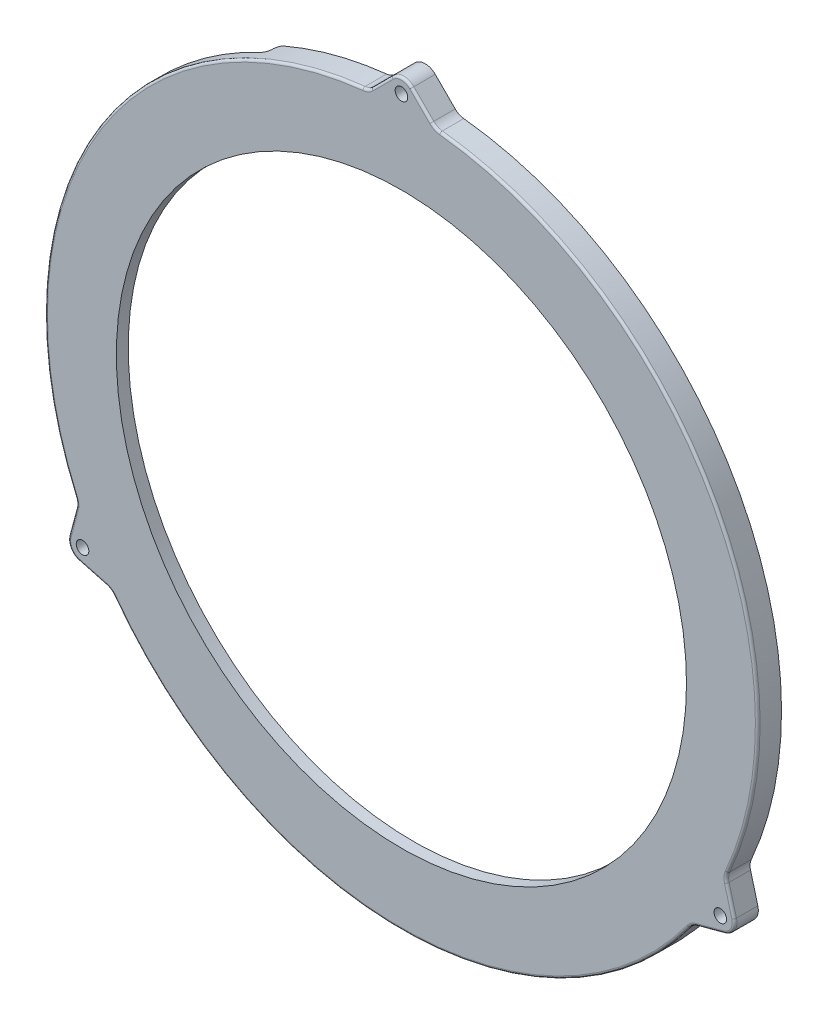
from build123d import *
from build123d.topology import SkipClean

# Parameters (mm, degrees)
SKETCH1_R                = 150
SKETCH1_R_2              = 140
BOSS_EXTRUDE1_DEPTH      = 5
SKETCH2_R                = 150
SKETCH2_R_2              = 120
BOSS_EXTRUDE2_DEPTH      = 5
BOSS_EXTRUDE3_START      = -10
SKETCH3_R                = 2.65
BOSS_EXTRUDE3_DEPTH      = 10
FILLET1_R                = 6
CIRPATTERN1_COUNT        = 3
FILLET1_OF_CIRPATTERN1_R = 6
FILLET2_R                = 1
CUT_EXTRUDE2_DEPTH       = 5
FILLET3_R                = 2.5


with BuildPart() as part:
    # Sketch1 → Boss-Extrude1 (new body)
    with BuildSketch(Plane.XY):
        Circle(SKETCH1_R)
        Circle(SKETCH1_R_2, mode=Mode.SUBTRACT)
    extrude(amount=BOSS_EXTRUDE1_DEPTH)

    # Sketch2 → Boss-Extrude2 (add)
    with BuildSketch(Plane.XY.offset(5)):
        Circle(SKETCH2_R)
        Circle(SKETCH2_R_2, mode=Mode.SUBTRACT)
    extrude(amount=BOSS_EXTRUDE2_DEPTH)

    # Sketch3 → Boss-Extrude3 (add)
    with BuildSketch(Plane.XY.offset(10).offset(BOSS_EXTRUDE3_START)):
        with BuildLine():
            ThreePointArc((-14.154618867, 149.330662507), (0, 150), (14.154618867, 149.330662507))
            Line((14.154618867, 149.330662507), (4.242640687, 159.242640687))
            ThreePointArc((4.242640687, 159.242640687), (0, 161), (-4.242640687, 159.242640687))
            Line((-4.242640687, 159.242640687), (-14.154618867, 149.330662507))
        make_face()
        with Locations((0, 155)):
            Circle(SKETCH3_R, mode=Mode.SUBTRACT)
    boss_extrude3 = extrude(amount=BOSS_EXTRUDE3_DEPTH)

    # Fillet1
    fillet1_edges = [part.edges().sort_by_distance(p)[0] for p in [
        (-14.154618867, 149.330662507, 5),
        (14.154618867, 149.330662507, 5),
    ]]
    fillet(fillet1_edges, radius=FILLET1_R)

    # CirPattern1: Boss-Extrude3 ×3 about axis
    cirpattern1_axis = Axis((0, 0, 0), (0, 0, 1))
    for i in range(1, CIRPATTERN1_COUNT):
        add(boss_extrude3.rotate(cirpattern1_axis, i * 360 / CIRPATTERN1_COUNT))

    # Fillet1 of CirPattern1
    fillet1_of_cirpattern1_edges = [part.edges().sort_by_distance(p)[0] for p in [
        (-122.246837861, -86.923590773, 5),
        (-136.401456729, -62.407071733, 5),
        (136.401456729, -62.407071733, 5),
        (122.246837861, -86.923590773, 5),
    ]]
    fillet(fillet1_of_cirpattern1_edges, radius=FILLET1_OF_CIRPATTERN1_R)

    # Fillet2
    fillet2_edges = [part.edges().sort_by_distance(p)[0] for p in [
        (8.443648708, 155.041632666, 10),
        (0, 161, 10),
        (-8.443648708, 155.041632666, 10),
        (-129.903810568, 75, 10),
        (-14.29409564, 149.672599518, 10),
        (14.29409564, 149.672599518, 10),
        (-138.491816887, -70.208402051, 10),
        (-139.430090009, -80.5, 10),
        (-130.048168179, -84.833230615, 10),
        (130.048168179, -84.833230615, 10),
        (139.430090009, -80.5, 10),
        (138.491816887, -70.208402051, 10),
        (0, -150, 10),
        (-122.473225614, -87.215349707, 10),
        (-136.767321253, -62.457249811, 10),
        (129.903810568, 75, 10),
        (136.767321253, -62.457249811, 10),
        (122.473225614, -87.215349707, 10),
    ]]
    fillet(fillet2_edges, radius=FILLET2_R)

    # Sketch4 → Cut-Extrude2 (cut)
    with SkipClean():  # the faces are left unmerged after this step: merging them gives an invalid solid
        with BuildSketch(Plane(origin=(0, 0, 0), x_dir=(-1, 0, 0), z_dir=(0, 0, -1))):
            with BuildLine():
                ThreePointArc((57.604193668, 127.599987743), (88.666685349, 108.343061196), (113.686688952, 81.702734074))
                Line((113.686688952, 81.702734074), (121.807166734, 87.538643651))
                ThreePointArc((121.807166734, 87.538643651), (95.000020016, 116.081851281), (61.718778929, 136.714272581))
                Line((61.718778929, 136.714272581), (57.604193668, 127.599987743))
            make_face()
            with BuildLine():
                ThreePointArc((55.546901037, 123.042845323), (85.500018015, 104.473666153), (109.626450061, 78.784779286))
                Line((109.626450061, 78.784779286), (113.686688952, 81.702734074))
                ThreePointArc((113.686688952, 81.702734074), (88.666685349, 108.343061196), (57.604193668, 127.599987743))
                Line((57.604193668, 127.599987743), (55.546901037, 123.042845323))
            make_face()
            with BuildLine():
                Line((113.686688952, 81.702734074), (109.626450061, 78.784779286))
                ThreePointArc((109.626450061, 78.784779286), (128.500137662, 41.384956456), (135, 0))
                ThreePointArc((135, 0), (-113.410386738, -73.233081186), (55.546901037, 123.042845323))
                Line((55.546901037, 123.042845323), (57.604193668, 127.599987743))
                ThreePointArc((57.604193668, 127.599987743), (-117.610771432, -75.945417526), (140, 0))
                ThreePointArc((140, 0), (133.25940202, 42.917732621), (113.686688952, 81.702734074))
            make_face()
        extrude(amount=-CUT_EXTRUDE2_DEPTH, mode=Mode.SUBTRACT)

    # Fillet3
    # the kernel refuses this fillet: 2.5 mm, written as the material it adds along each edge
    with BuildSketch(Plane(origin=(-55.032577879, 121.903559718, 5), x_dir=(0, 0, -1), z_dir=(-0.41145852619651707, 0.9114284838758278, 0))) as fillet3_piece_1_section:
        with BuildLine():
            CenterArc((FILLET3_R, FILLET3_R), FILLET3_R, 180, 90)
            Line((0, FILLET3_R), (0, 0))
            Line((0, 0), (FILLET3_R, 0))
        make_face()
    fillet3_piece_1 = extrude(amount=22.5, mode=Mode.PRIVATE)
    fillet3_piece_1 = fillet3_piece_1 & Plane(origin=(0, 0, 4.434016132), x_dir=(1, 0, 0), z_dir=(0, 0, -1)) * Cylinder(150, 56, mode=Mode.PRIVATE)
    fillet3_piece_1 = fillet3_piece_1 - Plane(origin=(0, 0, 4.434016132), x_dir=(1, 0, 0), z_dir=(0, 0, -1)) * Cylinder(140, 56, mode=Mode.PRIVATE)
    add(fillet3_piece_1)
    with BuildSketch(Plane(origin=(-108.611390338, 78.055290588, 5), x_dir=(0, 0, -1), z_dir=(-0.8120477782278018, 0.5835909576709453, 0))) as fillet3_piece_2_section:
        with BuildLine():
            CenterArc((FILLET3_R, -FILLET3_R), FILLET3_R, 90, 90)
            Line((0, -FILLET3_R), (0, 0))
            Line((0, 0), (FILLET3_R, 0))
        make_face()
    fillet3_piece_2 = extrude(amount=22.5, mode=Mode.PRIVATE)
    fillet3_piece_2 = fillet3_piece_2 & Plane(origin=(0, 0, 4.434018279), x_dir=(1, 0, 0), z_dir=(0, 0, -1)) * Cylinder(150, 55, mode=Mode.PRIVATE)
    fillet3_piece_2 = fillet3_piece_2 - Plane(origin=(0, 0, 4.434018279), x_dir=(-0.41145852619650086, 0.9114284838758352, 0), z_dir=(0, 0, -1)) * Cylinder(140, 55, mode=Mode.PRIVATE)
    add(fillet3_piece_2)
    # the kernel refuses this fillet: 2.5 mm, written as the material it takes off along each edge
    with BuildSketch(Plane(origin=(-64.290394718, 142.410700606, 0), x_dir=(0.9114284838758278, 0.4114585261965171, 0), z_dir=(0.41145852619651707, -0.9114284838758278, 0))) as fillet3_2_piece_1:
        with BuildLine():
            CenterArc((FILLET3_R, FILLET3_R), FILLET3_R, 180, 90)
            Line((0, FILLET3_R), (0, 0))
            Line((0, 0), (FILLET3_R, 0))
        make_face()
    extrude(amount=22.5, mode=Mode.SUBTRACT)
    with BuildSketch(Plane(origin=(-126.882465348, 91.186087136, 0), x_dir=(-0.5835909576709452, -0.8120477782278016, 0), z_dir=(0.8120477782278018, -0.5835909576709453, 0))) as fillet3_2_piece_2:
        with BuildLine():
            CenterArc((FILLET3_R, -FILLET3_R), FILLET3_R, 90, 90)
            Line((0, -FILLET3_R), (0, 0))
            Line((0, 0), (FILLET3_R, 0))
        make_face()
    extrude(amount=22.5, mode=Mode.SUBTRACT)


solid = part.part
